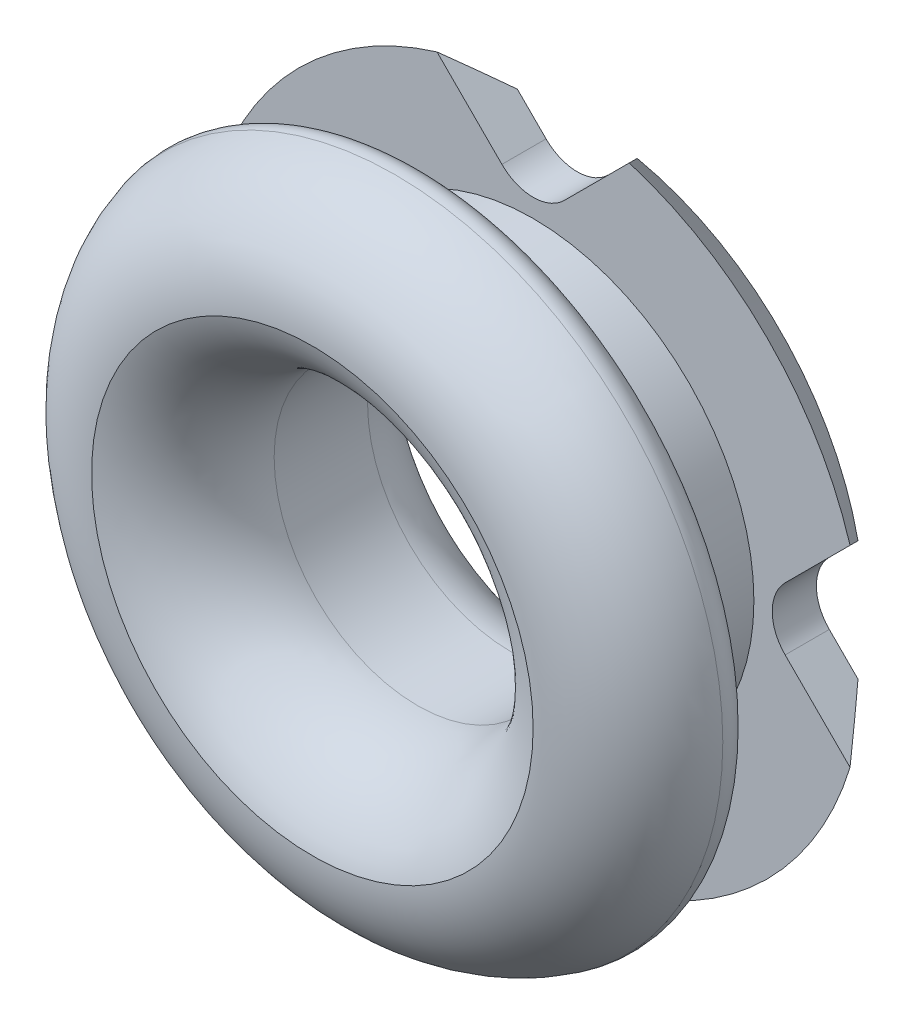
from build123d import *

# Parameters (mm, degrees)
SKETCH1_R           = 1
SKETCH1_R_2         = 0.65
BOSS_EXTRUDE1_DEPTH = 0.5
SKETCH3_R           = 1.5
SKETCH3_R_2         = 0.65
BOSS_EXTRUDE4_DEPTH = 0.5
BOSS_EXTRUDE5_START = 0.2
SKETCH4_R           = 0.65
BOSS_EXTRUDE5_DEPTH = 0.2
FILLET4_R           = 0.5
FILLET5_R           = 0.5
FILLET6_R           = 0.1
CHAMFER2_SIZE       = 0.2
FILLET8_R           = 0.2
FILLET9_R           = 0.1
FILLET10_R          = 0.3


# Some blends are built 0.0001 mm under size
with BuildPart() as part:
    # Sketch1 → Boss-Extrude1 (new body)
    with BuildSketch(Plane.XY):
        Circle(SKETCH1_R)
        Circle(SKETCH1_R_2, mode=Mode.SUBTRACT)
    extrude(amount=BOSS_EXTRUDE1_DEPTH)

    # Sketch3 → Boss-Extrude4 (add)
    with BuildSketch(Plane.XY.offset(0.5)):
        Circle(SKETCH3_R)
        Circle(SKETCH3_R_2, mode=Mode.SUBTRACT)
    extrude(amount=BOSS_EXTRUDE4_DEPTH)

    # Sketch4 → Boss-Extrude5 (add)
    with BuildSketch(Plane(origin=(0, 0, 0), x_dir=(-1, 0, 0), z_dir=(0, 0, -1)).offset(BOSS_EXTRUDE5_START)):
        with BuildLine():
            Line((0, 1), (-0.435414347, 1.435414347))
            ThreePointArc((-0.435414347, 1.435414347), (-1.060660172, 1.060660172), (-1.435414347, 0.435414347))
            Line((-1.435414347, 0.435414347), (-1, 0))
            Line((-1, 0), (-1.435414347, -0.435414347))
            ThreePointArc((-1.435414347, -0.435414347), (-1.060660172, -1.060660172), (-0.435414347, -1.435414347))
            Line((-0.435414347, -1.435414347), (0, -1))
            Line((0, -1), (0.435414347, -1.435414347))
            ThreePointArc((0.435414347, -1.435414347), (1.060660172, -1.060660172), (1.435414347, -0.435414347))
            Line((1.435414347, -0.435414347), (1, 0))
            Line((1, 0), (1.435414347, 0.435414347))
            ThreePointArc((1.435414347, 0.435414347), (1.060660172, 1.060660172), (0.435414347, 1.435414347))
            Line((0.435414347, 1.435414347), (0, 1))
        make_face()
        Circle(SKETCH4_R, mode=Mode.SUBTRACT)
    extrude(amount=-BOSS_EXTRUDE5_DEPTH)

    # Fillet4
    fillet4_edges = [part.edges().sort_by_distance(p)[0] for p in [
        (-1.5, 0, 1),
    ]]
    fillet(fillet4_edges, radius=FILLET4_R - 0.0001)  # a hair under: the kernel refuses the full size

    # Fillet5
    # the kernel refuses this fillet: 0.5 mm, written as the material it takes off along each edge
    with BuildSketch(Plane(origin=(0, 0, 1), x_dir=(1, 0, 0), z_dir=(0, -1, 0))) as fillet5_piece_1:
        with BuildLine():
            CenterArc((1.15, -0.477001038), FILLET5_R, 107.44559106, 72.55440894)
            Line((0.65, -0.477001038), (0.64, -0.477001038))
            Line((0.64, -0.477001038), (0.64, 0))
            Line((0.64, 0), (0.65, 0.01))
            ThreePointArc((0.65, 0.01), (0.82505, 0.01), (0.997102, 0.009540021))
            Line((0.997102, 0.009540021), (1.0001, 0))
        make_face()
    revolve(axis=Axis((0, 0, 1), (0, 0, 1)), mode=Mode.SUBTRACT)

    # Fillet6
    fillet6_edges = [part.edges().sort_by_distance(p)[0] for p in [
        (-1.5, 0, 0.5),
    ]]
    fillet(fillet6_edges, radius=FILLET6_R)

    # Chamfer2
    chamfer2_edges = [part.edges().sort_by_distance(p)[0] for p in [
        (-1.060660172, -1.060660172, -0.2),
        (-1.060660172, 1.060660172, -0.2),
        (1.060660172, 1.060660172, -0.2),
        (1.060660172, -1.060660172, -0.2),
    ]]
    chamfer(chamfer2_edges, length=CHAMFER2_SIZE - 0.0001)  # a hair under: the kernel refuses the full size

    # Fillet8
    # the kernel refuses this fillet: 0.2 mm, written as the material it adds along each edge
    with BuildSketch(Plane(origin=(0, 1, -0.2), x_dir=(-0.7071067811865487, 0.7071067811865465, 0), z_dir=(0, 0, 1)), Plane(origin=(-1, 0, -0.2), x_dir=(-0.7071067811865464, -0.7071067811865487, 0), z_dir=(0, 0, 1))) as fillet8_piece_1:
        with BuildLine():
            CenterArc((FILLET8_R, -FILLET8_R), FILLET8_R, 90, 90)
            Line((0, -FILLET8_R), (0, 0))
            Line((0, 0), (FILLET8_R, 0))
        make_face()
    extrude(amount=0.2)
    with BuildSketch(Plane(origin=(1, 0, -0.2), x_dir=(0.707106781186541, -0.707106781186554, 0), z_dir=(0, 0, 1)), Plane(origin=(0, -1, -0.2), x_dir=(-0.707106781186554, -0.707106781186541, 0), z_dir=(0, 0, 1))) as fillet8_piece_2:
        with BuildLine():
            CenterArc((FILLET8_R, FILLET8_R), FILLET8_R, 180, 90)
            Line((0, FILLET8_R), (0, 0))
            Line((0, 0), (FILLET8_R, 0))
        make_face()
    extrude(amount=0.2)

    # Fillet9
    fillet9_edges = [part.edges().sort_by_distance(p)[0] for p in [
        (-0.919309526, -0.919309526, -0.2),
    ]]
    fillet(fillet9_edges, radius=FILLET9_R)

    # Fillet10
    # the kernel refuses this fillet: 0.3 mm, written as the material it takes off along each edge
    with BuildSketch(Plane(origin=(0, 0, -0.2), x_dir=(-1, 0, 0), z_dir=(0, -1, 0))) as fillet10_piece_1:
        with BuildLine():
            CenterArc((0.65 + FILLET10_R, -FILLET10_R), FILLET10_R, 90, 90)
            Line((0.65, -FILLET10_R), (0.65, 0))
            Line((0.65, 0), (0.65 + FILLET10_R, 0))
        make_face()
    revolve(axis=Axis((0, 0, -0.2), (0, 0, -1)), mode=Mode.SUBTRACT)


solid = part.part
